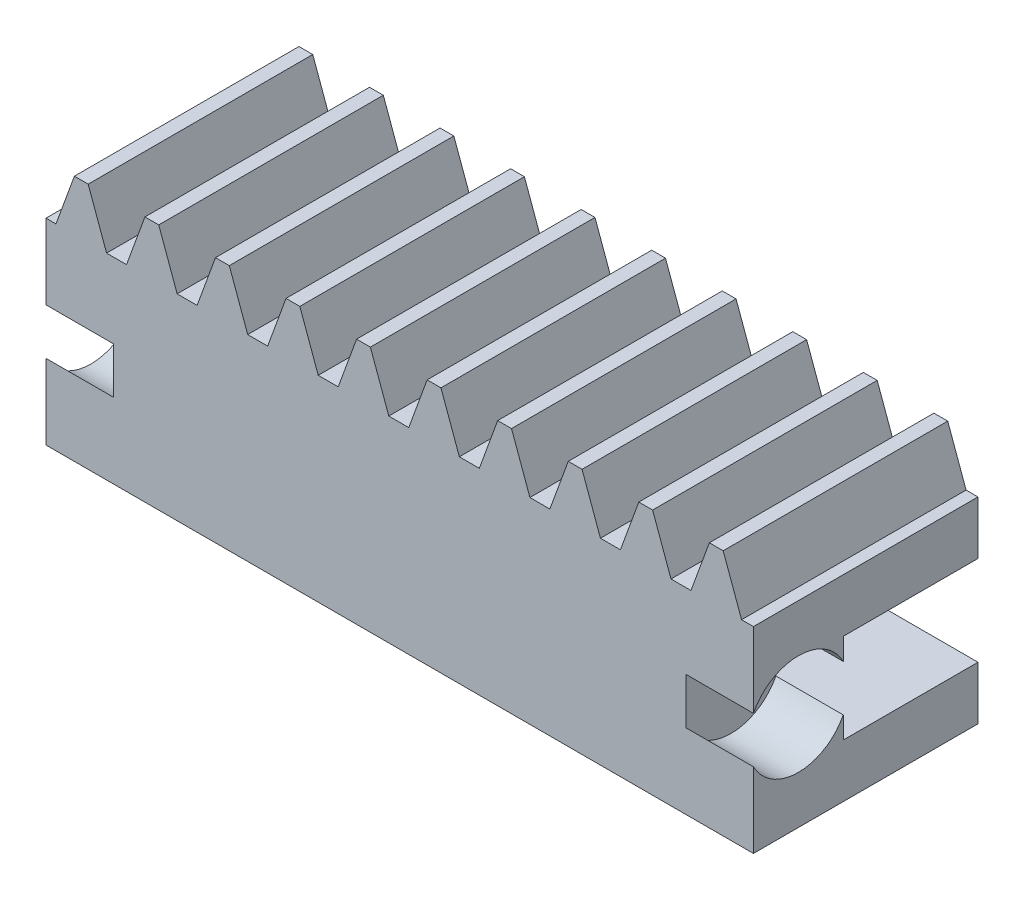
from build123d import *

# Parameters (mm, degrees)
BLANKSKE_W              = 800
BLANKSKE_H              = 11
BLANK_DEPTH             = 10
TOOTHCUTSIM_DEPTH       = 801.138113078
TEETHCUTS_COUNT         = 255
TEETHCUTS_PITCH         = 3.14159265
CUT_EXTRUDE1_DEPTH      = 801.138113078
CUT_EXTRUDE1_DEPTH_BACK = 801.138113078
SKETCH1_W               = 6
SKETCH1_H               = 4
CUT_EXTRUDE2_DEPTH      = 801.138113078
CUT_EXTRUDE2_DEPTH_BACK = 801.138113078
SKETCH3_OUTSIDE_W       = 962.028
SKETCH3_OUTSIDE_H       = 173.028
SKETCH3_OUTSIDE_W_2     = 31.5
SKETCH3_OUTSIDE_H_2     = 25.836038267
CUT_EXTRUDE3_DEPTH      = 35.8317384
CUT_EXTRUDE3_DEPTH_BACK = 3
SKETCH4_R               = 2.25
CUT_EXTRUDE4_START      = -28.5
SKETCH4_2_R             = 2.25
CUT_EXTRUDE4_DEPTH      = 3


with BuildPart() as part:
    # BlankSke → Blank (new body)
    with BuildSketch(Plane.XY):
        with Locations((400, 5.5)):
            Rectangle(BLANKSKE_W, BLANKSKE_H)
    extrude(amount=-BLANK_DEPTH)

    # TooCutSkeSim → ToothCutSim (cut, through all)
    with BuildSketch(Plane.XY):
        Polygon((0.44443537, 8.75), (-0.44443537, 8.75), (-1.272613241, 11.0254), (1.272613241, 11.0254), align=None)
    toothcutsim = extrude(amount=-TOOTHCUTSIM_DEPTH, mode=Mode.SUBTRACT)

    # TeethCuts: ToothCutSim ×255
    with Locations(*[(i * TEETHCUTS_PITCH, 0, 0) for i in range(1, TEETHCUTS_COUNT)]):
        add(toothcutsim, mode=Mode.SUBTRACT)

    # Sketch1 → Cut-Extrude1 (cut, two sides: drawn at the far end of the back side and taken through both)
    with BuildSketch(Plane(origin=(800, 0, 0), x_dir=(0, 0, -1), z_dir=(1, 0, 0)).offset(-CUT_EXTRUDE1_DEPTH_BACK)):
        with Locations((7, 4.375)):
            Rectangle(SKETCH1_W, SKETCH1_H)
    extrude(amount=CUT_EXTRUDE1_DEPTH + CUT_EXTRUDE1_DEPTH_BACK, mode=Mode.SUBTRACT)

    # Sketch3 outside → Cut-Extrude2 (cut, two sides: drawn at the far end of the back side and taken through both)
    with BuildSketch(Plane.XY.offset(-CUT_EXTRUDE2_DEPTH_BACK)):
        with Locations((400, 5.5)):
            Rectangle(SKETCH3_OUTSIDE_W, SKETCH3_OUTSIDE_H)
        with Locations((15.75, 12.918019134)):
            Rectangle(SKETCH3_OUTSIDE_W_2, SKETCH3_OUTSIDE_H_2, mode=Mode.SUBTRACT)
    extrude(amount=CUT_EXTRUDE2_DEPTH + CUT_EXTRUDE2_DEPTH_BACK, mode=Mode.SUBTRACT)

    # Sketch4 → Cut-Extrude3 (cut, two sides: drawn at the far end of the back side and taken through both)
    with BuildSketch(Plane(origin=(31.5, 0, 0), x_dir=(0, 0, -1), z_dir=(1, 0, 0)).offset(-CUT_EXTRUDE3_DEPTH_BACK)):
        with Locations((2, 4.375)):
            Circle(SKETCH4_R)
    extrude(amount=CUT_EXTRUDE3_DEPTH + CUT_EXTRUDE3_DEPTH_BACK, mode=Mode.SUBTRACT)

    # Sketch4<2> → Cut-Extrude4 (cut)
    with BuildSketch(Plane(origin=(31.5, 0, 0), x_dir=(0, 0, -1), z_dir=(1, 0, 0)).offset(CUT_EXTRUDE4_START)):
        with Locations((2, 4.375)):
            Circle(SKETCH4_2_R)
    extrude(amount=-CUT_EXTRUDE4_DEPTH, mode=Mode.SUBTRACT)


solid = part.part
